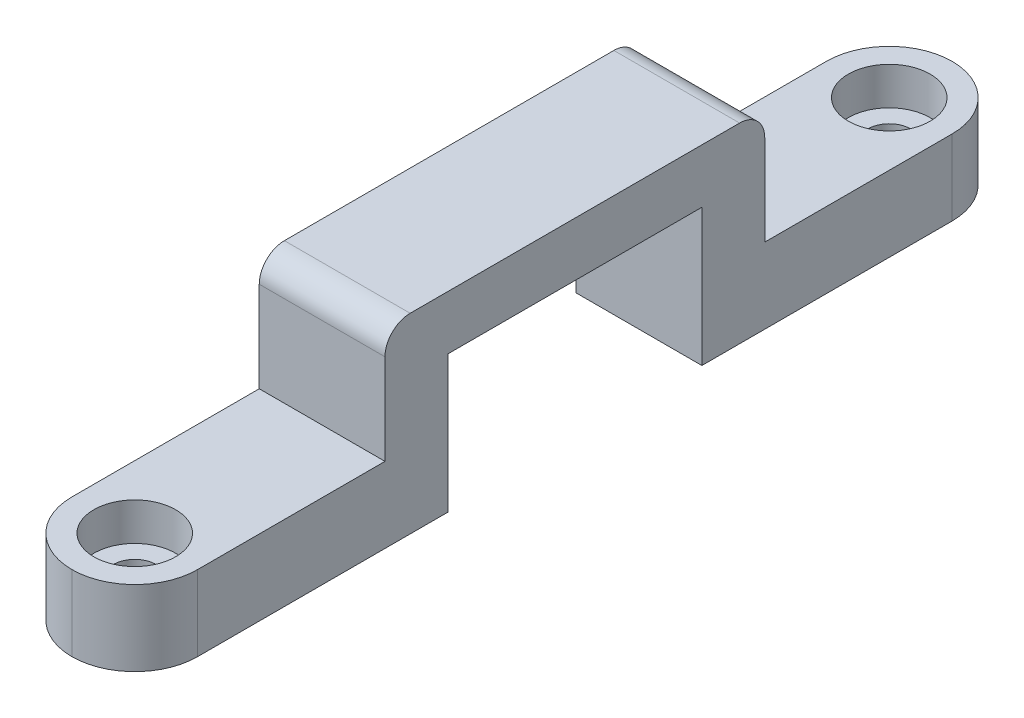
from build123d import *

# Parameters (mm, degrees)
RESSALTO_EXTRUS_O1_DEPTH          = 10
REBAIXO_PARA_SHCS_M31_D           = 3.4
REBAIXO_PARA_SHCS_M31_CBORE_D     = 6.5
REBAIXO_PARA_SHCS_M31_CBORE_DEPTH = 3
ESBO_O5_W                         = 20.2
ESBO_O5_H                         = 10.9
CORTE_EXTRUS_O1_DEPTH             = 73.325928961
FILETE1_R                         = 5
FILETE2_R                         = 2


with BuildPart() as part:
    # Esboço1 → Ressalto-extrusão1 (new body)
    with BuildSketch(Plane(origin=(0, 0, 0), x_dir=(0, 0, -1), z_dir=(1, 0, 0))):
        Polygon((0, 0), (0, 6), (19.9, 6), (19.9, 15.2), (50.1, 15.2), (50.1, 6), (70, 6), (70, 0), align=None)
    extrude(amount=RESSALTO_EXTRUS_O1_DEPTH)

    # Rebaixo para SHCS M31 (through all)
    with Locations(Plane(origin=(0, 6, 0), x_dir=(1, 0, 0), z_dir=(0, 1, 0))):
        with Locations((5, 5), (5, 65)):
            CounterBoreHole(REBAIXO_PARA_SHCS_M31_D / 2, REBAIXO_PARA_SHCS_M31_CBORE_D / 2, REBAIXO_PARA_SHCS_M31_CBORE_DEPTH)

    # Esboço5 → Corte-extrusão1 (cut, through all)
    with BuildSketch(Plane(origin=(10, 0, 0), x_dir=(0, 0, -1), z_dir=(1, 0, 0))):
        with Locations((35, 5.45)):
            Rectangle(ESBO_O5_W, ESBO_O5_H)
    extrude(amount=-CORTE_EXTRUS_O1_DEPTH, mode=Mode.SUBTRACT)

    # Filete1
    filete1_edges = [part.edges().sort_by_distance(p)[0] for p in [
        (10, 3, 0),
        (0, 3, 0),
        (10, 3, -70),
        (0, 3, -70),
    ]]
    fillet(filete1_edges, radius=FILETE1_R - 0.0001)  # a hair under: the kernel refuses the full size

    # Filete2
    filete2_edges = [part.edges().sort_by_distance(p)[0] for p in [
        (5, 15.2, -19.9),
        (5, 15.2, -50.1),
    ]]
    fillet(filete2_edges, radius=FILETE2_R)


solid = part.part
